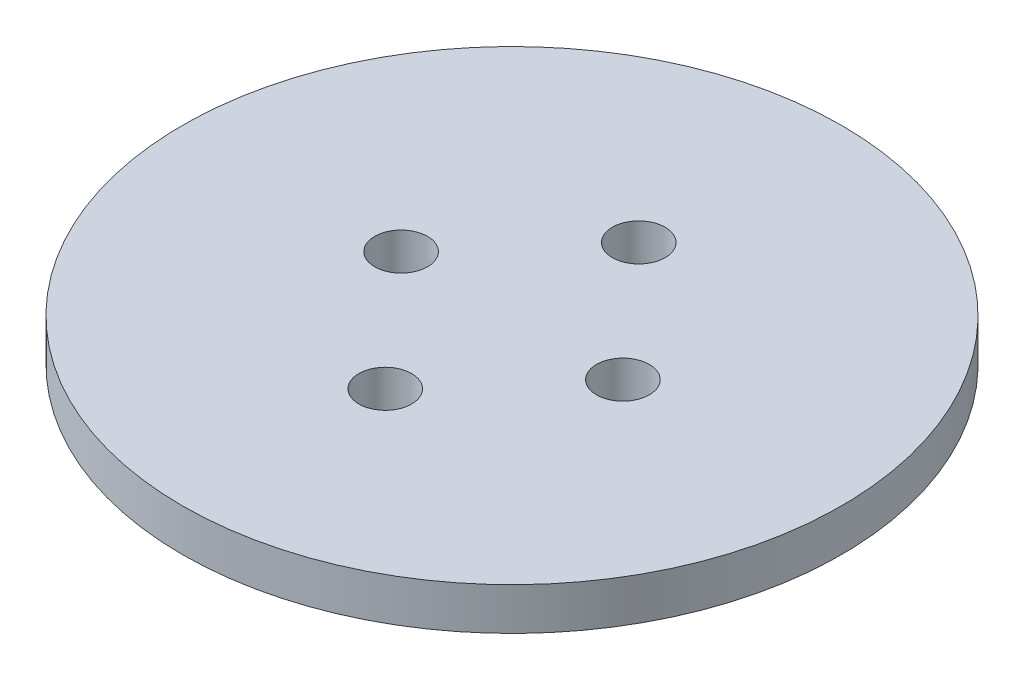
from build123d import *

# Parameters (mm, degrees)
SKETCH1_R            = 49.53
BOSS_EXTRUDE1_DEPTH  = 6.35
THREADED_ROD_HOLES_D = 7.9375
U_BOLT_HOLES_D       = 7.9375


with BuildPart() as part:
    # Sketch1 → Boss-Extrude1 (new body)
    with BuildSketch(Plane(origin=(0, 0, 0), x_dir=(1, 0, 0), z_dir=(0, 1, 0))):
        Circle(SKETCH1_R)
    extrude(amount=BOSS_EXTRUDE1_DEPTH)

    # Threaded Rod Holes (through all)
    with Locations(Plane(origin=(0, 6.35, 0), x_dir=(1, 0, 0), z_dir=(0, 1, 0))):
        with Locations((0, 19.05), (0, -19.05)):
            Hole(THREADED_ROD_HOLES_D / 2)

    # U-Bolt Holes (through all)
    with Locations(Plane(origin=(0, 6.35, 0), x_dir=(1, 0, 0), z_dir=(0, 1, 0))):
        with Locations((-16.66875, 0), (16.66875, 0)):
            Hole(U_BOLT_HOLES_D / 2)


solid = part.part
